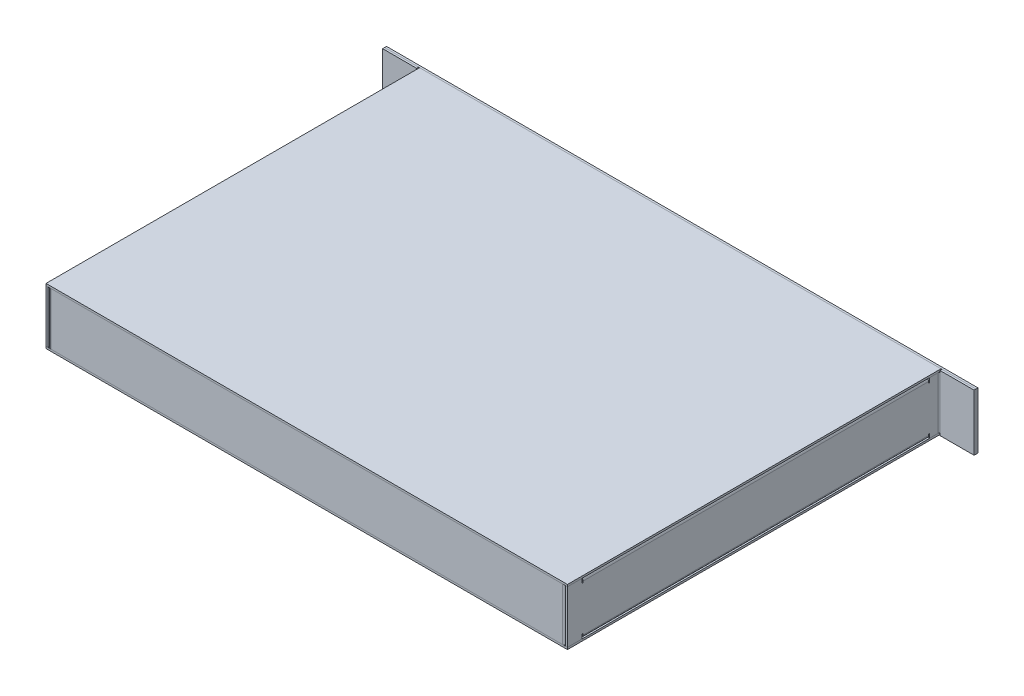
from build123d import *

# Parameters (mm, degrees)
SKETCH1_W                    = 425.45
SKETCH1_H                    = 304.8
BASE_FLANGE1_DEPTH           = 1.6002
LPATTERN1_COUNT              = 2
LPATTERN1_PITCH              = 44.45
BASE_FLANGE2_DEPTH           = 42.8498
BASE_FLANGE3_DEPTH           = 42.8498
SKETCH14_W                   = 27.813
SKETCH14_H                   = 1.6002
TAB1_DEPTH                   = 1.6002
EDGE_FLANGE1_START           = 210.3628
EDGE_FLANGE1_DEPTH           = 3.6372
EDGE_FLANGE1_START_2         = 202.565
EDGE_FLANGE1_2_OUTLINE_W     = 1.6002
EDGE_FLANGE1_2_OUTLINE_H     = 281.885411204
EDGE_FLANGE1_2_DEPTH         = 7.7978
EDGE_FLANGE1_START_3         = -142.24
EDGE_FLANGE1_3_DEPTH         = 281.885411204
EDGE_FLANGE1_4_DEPTH         = 281.885411204
MIRROR1_START                = 210.3628
MIRROR1_DEPTH                = 3.6372
MIRROR1_START_2              = 202.565
MIRROR1_2_OUTLINE_W          = 1.6002
MIRROR1_2_OUTLINE_H          = 281.885411204
MIRROR1_2_DEPTH              = 7.7978
MIRROR1_START_3              = -142.24
MIRROR1_3_DEPTH              = 281.885411204
MIRROR1_4_DEPTH              = 281.885411204
SKETCH33_W                   = 482.6
SKETCH33_H                   = 46.0502
BASE_FLANGE4_DEPTH           = 1.6002
SKETCH34_R                   = 2.921
SKETCH34_W                   = 63.5
SKETCH34_H                   = 19.05
CUT_EXTRUDE1_DEPTH           = 127
LPATTERN2_COUNT              = 4
LPATTERN2_PITCH              = 101.6
SKETCH35_W                   = 101.6
SKETCH35_H                   = 25.4
BASE_FLANGE5_DEPTH           = 1.6002
EDGE_FLANGE2_STRIP_W         = 7.9248
EDGE_FLANGE2_STRIP_H         = 1.6002
EDGE_FLANGE2_STRIP_CUT_DEPTH = 101.6
EDGE_FLANGE2_DEPTH           = 101.6
LPATTERN4_COUNT              = 4
LPATTERN4_PITCH              = 101.6


with BuildPart() as part:
    # Base-Flange1: sheet metal written as solids
    # Sketch1 → Base-Flange1 (new body)
    with BuildSketch(Plane(origin=(0, 0, 0), x_dir=(1, 0, 0), z_dir=(0, 1, 0))):
        Rectangle(SKETCH1_W, SKETCH1_H)
    extrude(amount=-BASE_FLANGE1_DEPTH)


with BuildPart() as lpattern1_1:
    # LPattern1: pattern copy
    add(part.part.moved(Location(Vector(0, 1, 0) * (1 * LPATTERN1_PITCH))))


with BuildPart() as body_3:
    # Base-Flange2: read off the stored shape, not the designer's step
    # Base-Flange2 outline → Base-Flange2 (new body)
    with BuildSketch(Plane(origin=(0, 0, 0), x_dir=(1, 0, 0), z_dir=(0, 1, 0))):
        with BuildLine():
            Line((211.1248, -150.0378), (211.1248, -139.7))
            Line((211.1248, -139.7), (209.5246, -139.7))
            Line((209.5246, -139.7), (209.5246, -150.0378))
            ThreePointArc((209.5246, -150.0378), (209.301415367, -150.576615367), (208.7626, -150.7998))
            Line((208.7626, -150.7998), (-208.7626, -150.7998))
            ThreePointArc((-208.7626, -150.7998), (-209.301415367, -150.576615367), (-209.5246, -150.0378))
            Line((-209.5246, -150.0378), (-209.5246, -139.7))
            Line((-209.5246, -139.7), (-211.1248, -139.7))
            Line((-211.1248, -139.7), (-211.1248, -150.0378))
            ThreePointArc((-211.1248, -150.0378), (-210.432927639, -151.708127639), (-208.7626, -152.4))
            Line((-208.7626, -152.4), (208.7626, -152.4))
            ThreePointArc((208.7626, -152.4), (210.432927639, -151.708127639), (211.1248, -150.0378))
        make_face()
    extrude(amount=BASE_FLANGE2_DEPTH)


with BuildPart() as body_4:
    # Base-Flange3: read off the stored shape, not the designer's step
    # Base-Flange3 outline → Base-Flange3 (new body)
    with BuildSketch(Plane(origin=(0, 0, 0), x_dir=(1, 0, 0), z_dir=(0, 1, 0))):
        with BuildLine():
            Line((213.487, 150.7998), (241.3, 150.7998))
            Line((241.3, 150.7998), (241.3, 152.4))
            Line((241.3, 152.4), (213.487, 152.4))
            ThreePointArc((213.487, 152.4), (211.816672361, 151.708127639), (211.1248, 150.0378))
            Line((211.1248, 150.0378), (211.1248, -152.4))
            Line((211.1248, -152.4), (212.725, -152.4))
            Line((212.725, -152.4), (212.725, 150.0378))
            ThreePointArc((212.725, 150.0378), (212.948184633, 150.576615367), (213.487, 150.7998))
        make_face()
    extrude(amount=BASE_FLANGE3_DEPTH)

    # Tab1: sheet metal written as solids
    # Sketch14 → Tab1 (add)
    with BuildSketch(Plane(origin=(0, 0, -152.4), x_dir=(-1, 0, 0), z_dir=(0, 0, -1))):
        with Locations((-227.3935, 43.6499)):
            Rectangle(SKETCH14_W, SKETCH14_H)
        with Locations((-227.3935, -0.8001)):
            Rectangle(SKETCH14_W, SKETCH14_H)
    extrude(amount=-TAB1_DEPTH)

    # Edge-Flange1: read off the stored shape, not the designer's step
    # Edge-Flange1 outline → Edge-Flange1 (cut)
    with BuildSketch(Plane.YZ.offset(EDGE_FLANGE1_START)):
        with BuildLine():
            Line((3.1623, -142.24), (0, -142.24))
            Line((0, -142.24), (0, -143.0401))
            Line((0, -143.0401), (3.1623, -143.0401))
            ThreePointArc((3.1623, -143.0401), (3.56235, -142.64005), (3.1623, -142.24))
        make_face()
        with BuildLine():
            Line((0, 140.445511204), (0, 139.645411204))
            Line((0, 139.645411204), (3.1623, 139.645411204))
            ThreePointArc((3.1623, 139.645411204), (3.56235, 140.045461204), (3.1623, 140.445511204))
            Line((3.1623, 140.445511204), (0, 140.445511204))
        make_face()
    extrude(amount=EDGE_FLANGE1_DEPTH, mode=Mode.SUBTRACT)

    # Edge-Flange1 2 outline → Edge-Flange1 2 (add)
    with BuildSketch(Plane.YZ.offset(EDGE_FLANGE1_START_2)):
        with Locations((0.8001, -1.297294398)):
            Rectangle(EDGE_FLANGE1_2_OUTLINE_W, EDGE_FLANGE1_2_OUTLINE_H)
    extrude(amount=EDGE_FLANGE1_2_DEPTH)

    # Edge-Flange1 3 outline → Edge-Flange1 3 (cut)
    with BuildSketch(Plane.XY.offset(EDGE_FLANGE1_START_3)):
        with BuildLine():
            ThreePointArc((212.725, 2.3622), (212.283735351, 0.987428666), (211.1248, 0.126278525))
            Line((211.1248, 0.126278525), (211.1248, 0))
            Line((211.1248, 0), (212.725, 0))
            Line((212.725, 0), (212.725, 2.3622))
        make_face()
    extrude(amount=EDGE_FLANGE1_3_DEPTH, mode=Mode.SUBTRACT)

    # Edge-Flange1 4 outline → Edge-Flange1 4 (add)
    with BuildSketch(Plane.XY.offset(EDGE_FLANGE1_START_3)):
        with BuildLine():
            Line((210.3628, 1.6002), (210.3628, 0))
            ThreePointArc((210.3628, 0), (210.74899628, 0.031783455), (211.1248, 0.126278525))
            Line((211.1248, 0.126278525), (211.1248, 2.3622))
            ThreePointArc((211.1248, 2.3622), (210.901615367, 1.823384633), (210.3628, 1.6002))
        make_face()
    extrude(amount=EDGE_FLANGE1_4_DEPTH)

    # Mirror1: read off the stored shape, not the designer's step
    # Mirror1 outline → Mirror1 (cut)
    with BuildSketch(Plane.YZ.offset(MIRROR1_START)):
        with BuildLine():
            Line((39.6875, 139.645411204), (42.8498, 139.645411204))
            Line((42.8498, 139.645411204), (42.8498, 140.445511204))
            Line((42.8498, 140.445511204), (39.6875, 140.445511204))
            ThreePointArc((39.6875, 140.445511204), (39.28745, 140.045461204), (39.6875, 139.645411204))
        make_face()
        with BuildLine():
            Line((42.8498, -143.0401), (42.8498, -142.24))
            Line((42.8498, -142.24), (39.6875, -142.24))
            ThreePointArc((39.6875, -142.24), (39.28745, -142.64005), (39.6875, -143.0401))
            Line((39.6875, -143.0401), (42.8498, -143.0401))
        make_face()
    extrude(amount=MIRROR1_DEPTH, mode=Mode.SUBTRACT)

    # Mirror1 2 outline → Mirror1 2 (add)
    with BuildSketch(Plane.YZ.offset(MIRROR1_START_2)):
        with Locations((42.0497, -1.297294398)):
            Rectangle(MIRROR1_2_OUTLINE_W, MIRROR1_2_OUTLINE_H)
    extrude(amount=MIRROR1_2_DEPTH)

    # Mirror1 3 outline → Mirror1 3 (cut)
    with BuildSketch(Plane.XY.offset(MIRROR1_START_3)):
        with BuildLine():
            Line((211.1248, 42.8498), (211.1248, 42.723521475))
            ThreePointArc((211.1248, 42.723521475), (212.283735351, 41.862371334), (212.725, 40.4876))
            Line((212.725, 40.4876), (212.725, 42.8498))
            Line((212.725, 42.8498), (211.1248, 42.8498))
        make_face()
    extrude(amount=MIRROR1_3_DEPTH, mode=Mode.SUBTRACT)

    # Mirror1 4 outline → Mirror1 4 (add)
    with BuildSketch(Plane.XY.offset(MIRROR1_START_3)):
        with BuildLine():
            ThreePointArc((211.1248, 42.723521475), (210.74899628, 42.818016545), (210.3628, 42.8498))
            Line((210.3628, 42.8498), (210.3628, 41.2496))
            ThreePointArc((210.3628, 41.2496), (210.901615367, 41.026415367), (211.1248, 40.4876))
            Line((211.1248, 40.4876), (211.1248, 42.723521475))
        make_face()
    extrude(amount=MIRROR1_4_DEPTH)


with BuildPart() as body_5:
    # Mirror2: mirrored copy
    add(body_4.part.mirror(Plane(origin=(0, 0, 0), x_dir=(0, 0, 1), z_dir=(1, 0, 0))))


with BuildPart() as body_6:
    # Base-Flange4: sheet metal written as solids
    # Sketch33 → Base-Flange4 (new body)
    with BuildSketch(Plane(origin=(0, 0, -152.4), x_dir=(-1, 0, 0), z_dir=(0, 0, -1))):
        with Locations((0, 21.4249)):
            Rectangle(SKETCH33_W, SKETCH33_H)
    extrude(amount=BASE_FLANGE4_DEPTH)

    # Sketch34 → Cut-Extrude1 (cut)
    with BuildSketch(Plane(origin=(0, 0, -154.0002), x_dir=(-1, 0, 0), z_dir=(0, 0, -1))):
        with Locations((-187.325, 21.4249)):
            Circle(SKETCH34_R)
        with Locations((-104.775, 21.4249)):
            Circle(SKETCH34_R)
        with Locations((-146.05, 21.4249)):
            Rectangle(SKETCH34_W, SKETCH34_H)
    cut_extrude1 = extrude(amount=-CUT_EXTRUDE1_DEPTH, mode=Mode.SUBTRACT)

    # LPattern2: Cut-Extrude1 ×4
    with Locations(*[(-i * LPATTERN2_PITCH, 0, 0) for i in range(1, LPATTERN2_COUNT)]):
        add(cut_extrude1, mode=Mode.SUBTRACT)


with BuildPart() as body_7:
    # Base-Flange5: sheet metal written as solids
    # Sketch35 → Base-Flange5 (new body)
    with BuildSketch(Plane(origin=(0, 0, -154.0002), x_dir=(-1, 0, 0), z_dir=(0, 0, -1))):
        with Locations((-146.05, 21.4249)):
            Rectangle(SKETCH35_W, SKETCH35_H)
    extrude(amount=BASE_FLANGE5_DEPTH)

    # Edge-Flange2: sheet metal written as solids
    # Edge-Flange2 strip (on a plane across the edge) → Edge-Flange2 strip cut (cut)
    with BuildSketch(Plane(origin=(196.85, 8.7249, -155.6004), x_dir=(0, 1, 0), z_dir=(-1, 0, 0))):
        with Locations((-1.6002, -0.8001)):
            Rectangle(EDGE_FLANGE2_STRIP_W, EDGE_FLANGE2_STRIP_H)
    extrude(amount=EDGE_FLANGE2_STRIP_CUT_DEPTH, mode=Mode.SUBTRACT)

    # Edge-Flange2 section (on a plane across the edge) → Edge-Flange2 (add)
    with BuildSketch(Plane(origin=(196.85, 8.7249, -155.6004), x_dir=(0, 1, 0), z_dir=(-1, 0, 0))):
        with BuildLine():
            Line((0, 0.762), (0, 11.0998))
            Line((0, 11.0998), (1.6002, 11.0998))
            Line((1.6002, 11.0998), (1.6002, 0.762))
            ThreePointArc((1.6002, 0.762), (1.823384633, 0.223184633), (2.3622, 0))
            Line((2.3622, 0), (2.3622, -1.6002))
            ThreePointArc((2.3622, -1.6002), (0.691872361, -0.908327639), (0, 0.762))
        make_face()
    extrude(amount=EDGE_FLANGE2_DEPTH)


with BuildPart() as lpattern4_1:
    # LPattern4: pattern copy
    add(body_7.part.moved(Location(Vector(-1, 0, 0) * (1 * LPATTERN4_PITCH))))


with BuildPart() as lpattern4_2:
    # LPattern4: pattern copy
    add(body_7.part.moved(Location(Vector(-1, 0, 0) * (2 * LPATTERN4_PITCH))))


with BuildPart() as lpattern4_3:
    # LPattern4: pattern copy
    add(body_7.part.moved(Location(Vector(-1, 0, 0) * (3 * LPATTERN4_PITCH))))


solid = Compound([part.part, lpattern1_1.part, body_3.part, body_4.part, body_5.part, body_6.part, body_7.part, lpattern4_1.part, lpattern4_2.part, lpattern4_3.part])
